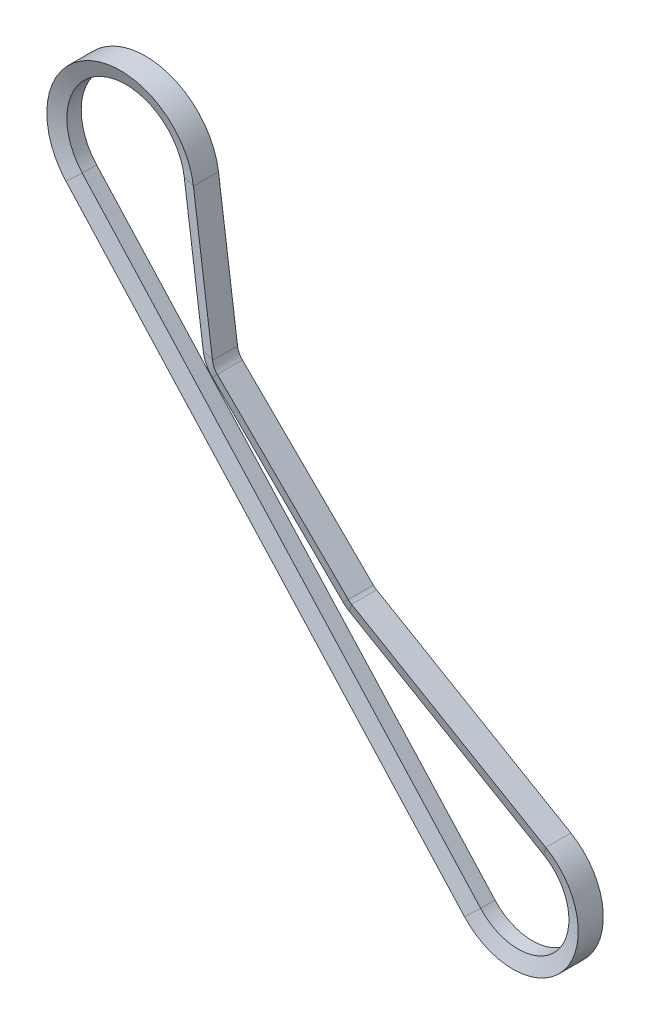
from build123d import *


with BuildPart() as part:
    # Sweep1: sweep along a path in Sketch2
    with BuildLine(Plane.XY) as sweep1_path:
        Line((-18.392182924, -16.74793223), (-169.866405058, 149.597474693))
        ThreePointArc((-169.866405058, 149.597474693), (-160.997016103, 193.826009308), (-121.414760103, 172.190983433))
        Line((-121.414760103, 172.190983433), (-114.17026832, 118.463042956))
        ThreePointArc((-114.17026832, 118.463042956), (-113.559913773, 116.477946082), (-112.341703108, 114.795951716))
        Line((-112.341703108, 114.795951716), (-62.563162884, 65.581147711))
        ThreePointArc((-62.563162884, 65.581147711), (-61.962681162, 65.057727626), (-61.301392403, 64.613605952))
        Line((-61.301392403, 64.613605952), (12.546069838, 21.479333284))
        ThreePointArc((12.546069838, 21.479333284), (19.335853142, -15.648974726), (-18.392182924, -16.74793223))
    # Sketch3 → Sweep1 (sweep)
    with BuildSketch(Plane(origin=(12.546069838, 21.479333284, 0), x_dir=(-0.5043646158972169, -0.8634907841030226, 0), z_dir=(0.8634907841030226, -0.5043646158972169, 0))):
        Polygon((0, -4.7625), (0, 4.7625), (5.588, 2.728634331), (5.588, -2.728634331), align=None)
    sweep(path=sweep1_path.line)


solid = part.part
